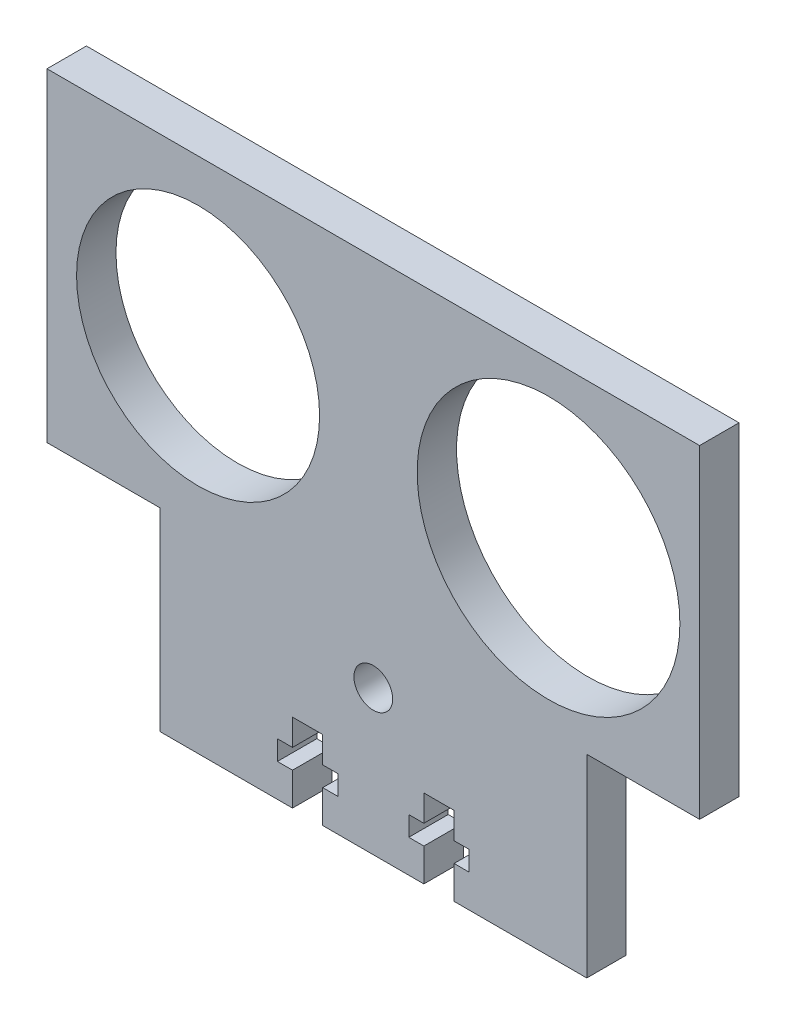
from build123d import *

# Parameters (mm, degrees)
SKETCH1_R           = 2.95
SKETCH1_R_2         = 20
SKETCH1_R_3         = 18.5
BOSS_EXTRUDE1_DEPTH = 6
CUT_EXTRUDE2_DEPTH  = 76.689323992


with BuildPart() as part:
    # Sketch1 → Boss-Extrude1 (new body)
    with BuildSketch(Plane.XY):
        Polygon((-32.5, 7.5), (-32.5, -22), (32.5, -22), (32.5, 7.5), (49.675685802, 7.5), (49.675685802, 56.790844389), (-49.675685802, 56.790844389), (-49.675685802, 7.5), align=None)
        Circle(SKETCH1_R, mode=Mode.SUBTRACT)
        with Locations((26.675685802, 31.790844389)):
            Circle(SKETCH1_R_2, mode=Mode.SUBTRACT)
        with Locations((-26.675685802, 31.790844389)):
            Circle(SKETCH1_R_3, mode=Mode.SUBTRACT)
    extrude(amount=BOSS_EXTRUDE1_DEPTH)

    # Sketch3 → Cut-Extrude2 (cut, through all)
    with BuildSketch(Plane.XY.offset(6)):
        Polygon((-12.3, -22), (-7.7, -22), (-7.7, -17), (-5.4, -17), (-5.4, -14), (-7.7, -14), (-7.7, -10), (-12.3, -10), (-12.3, -14), (-14.6, -14), (-14.6, -17), (-12.3, -17), align=None)
        Polygon((7.7, -14), (7.7, -10), (12.3, -10), (12.3, -14), (14.6, -14), (14.6, -17), (12.3, -17), (12.3, -22), (7.7, -22), (7.7, -17), (5.4, -17), (5.4, -14), align=None)
    extrude(amount=-CUT_EXTRUDE2_DEPTH, mode=Mode.SUBTRACT)


solid = part.part
